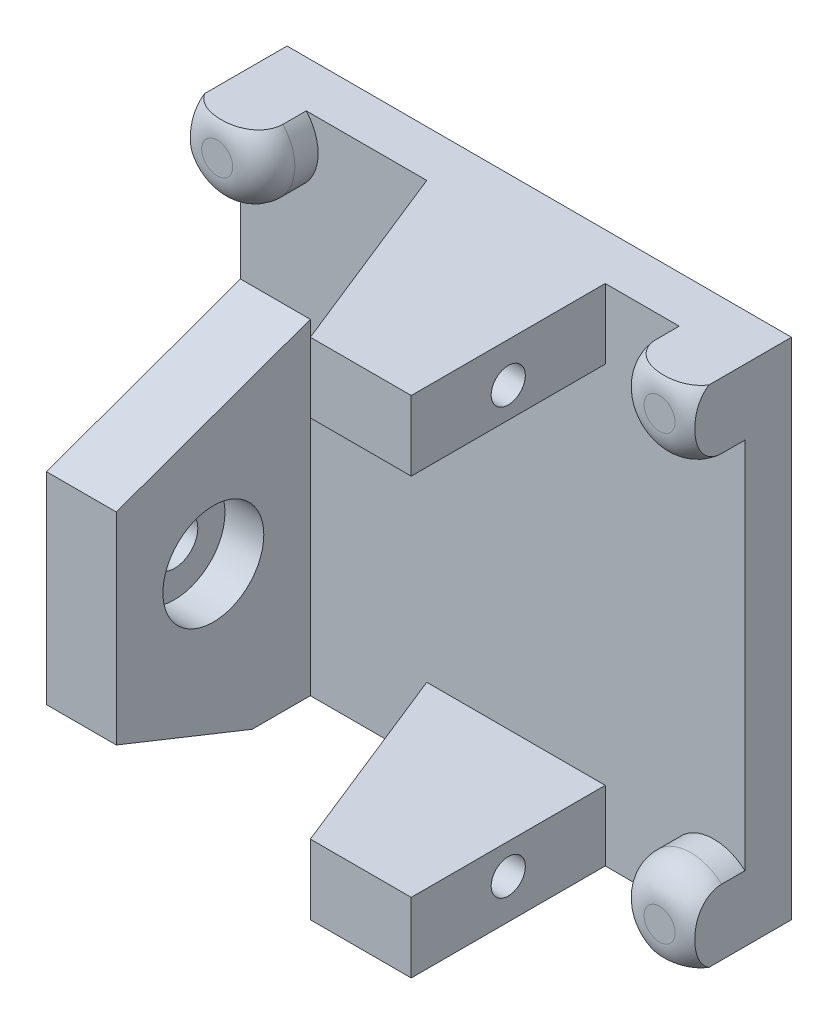
from build123d import *

# Parameters (mm, degrees)
EXTRUDE_640_DEPTH      = 6.25
SKETCH_5_W             = 2.5
SKETCH_5_H             = 8
CUT_EXTRUDE_957_DEPTH  = 4.5
SKETCH_1_W             = 32.5
SKETCH_1_H             = 32.5
EXTRUDE_1522_DEPTH     = 3
SKETCH_4_R             = 1.5
CUT_EXTRUDE_1878_DEPTH = 34.669348078
SKETCH_9_R             = 2.5
CUT_EXTRUDE_4358_DEPTH = 2.5
FILLET_3_R             = 2.5
SKETCH_10_W            = 12.5
SKETCH_10_H            = 12.5
CUT_EXTRUDE_4764_DEPTH = 39.52353177
CUT_EXTRUDE_5191_REACH = 39.495
SKETCH_13_W            = 12.5
SKETCH_13_H            = 16
SKETCH_13_H_2          = 3.5
CHAMFER_3_SIZE         = 5
CHAMFER_3_SIZE_2       = 12.5
SKETCH_5338_R          = 1.1
CUT_EXTRUDE_5550_DEPTH = 8
CHAMFER_START          = -14
CHAMFER_4_DEPTH        = 4.5
EXTRUDE_6314_DEPTH     = 3.5
SKETCH_15_R            = 1
CUT_EXTRUDE_6618_DEPTH = 6
SKETCH_17_R            = 3.25
CUT_EXTRUDE_7180_DEPTH = 2.5


with BuildPart() as part:
    # Эскиз2 → Extrude 640 (new, symmetric)
    with BuildSketch(Plane.XY):
        Polygon((9.5, 16.25), (-14, 16.25), (-14, -16.25), (9.5, -16.25), (9.5, -11.75), (-9.5, -11.75), (-9.5, 11.75), (9.5, 11.75), align=None)
    extrude(amount=EXTRUDE_640_DEPTH, both=True)

    # Эскиз5 → Cut-Extrude 957 (cut)
    with BuildSketch(Plane.XZ.offset(11.75)):
        with Locations((-4.2, 2.25)):
            Rectangle(SKETCH_5_W, SKETCH_5_H)
    extrude(amount=CUT_EXTRUDE_957_DEPTH, mode=Mode.SUBTRACT)

    # Эскиз1 → Extrude 1522 (add)
    with BuildSketch(Plane(origin=(0, 0, -6.25), x_dir=(-1, 0, 0), z_dir=(0, 0, -1))):
        with Locations((-2.25, 0)):
            Rectangle(SKETCH_1_W, SKETCH_1_H)
    extrude(amount=EXTRUDE_1522_DEPTH)

    # Эскиз4 → Cut-Extrude 1878 (cut, through all)
    with BuildSketch(Plane(origin=(-9.5, 0, 0), x_dir=(0, 0, -1), z_dir=(1, 0, 0))):
        with Locations(Location((0, -5.77, 0), (0, 0, 90))):
            Circle(SKETCH_4_R)
    extrude(amount=-CUT_EXTRUDE_1878_DEPTH, mode=Mode.SUBTRACT)

    # Эскиз9 → Cut-Extrude 4358 (cut)
    with BuildSketch(Plane(origin=(0, 0, -9.25), x_dir=(-1, 0, 0), z_dir=(0, 0, -1))):
        with Locations((-11.75, 0)):
            Circle(SKETCH_9_R)
        with Locations((7.25, 0)):
            Circle(SKETCH_9_R)
    extrude(amount=-CUT_EXTRUDE_4358_DEPTH, mode=Mode.SUBTRACT)

    # Скругление3
    fillet_3_edges = [part.edges().sort_by_distance(p)[0] for p in [
        (14.25, 0, -6.75),
        (-4.75, 0, -6.75),
    ]]
    fillet(fillet_3_edges, radius=FILLET_3_R - 0.0001)  # a hair under: the kernel refuses the full size

    # Эскиз10 → Cut-Extrude 4764 (cut, through all)
    with BuildSketch(Plane(origin=(0, 16.25, 0), x_dir=(1, 0, 0), z_dir=(0, 1, 0))):
        with Locations((-3.25, 0)):
            Rectangle(SKETCH_10_W, SKETCH_10_H)
    extrude(amount=-CUT_EXTRUDE_4764_DEPTH, mode=Mode.SUBTRACT)

    # Эскиз13 → Cut-Extrude 5191 (cut, up to next)
    with BuildSketch(Plane.ZY.offset(14), mode=Mode.PRIVATE) as cut_extrude_5191_sk1:
        with Locations((0, 8.25)):
            Rectangle(SKETCH_13_W, SKETCH_13_H)
    cut_extrude_5191_tool1 = extrude(cut_extrude_5191_sk1.sketch, amount=-CUT_EXTRUDE_5191_REACH, mode=Mode.PRIVATE) & part.part
    # Эскиз13 → Cut-Extrude 5191 (cut, up to next)
    with BuildSketch(Plane.ZY.offset(14), mode=Mode.PRIVATE) as cut_extrude_5191_sk2:
        with Locations((0, -14.5)):
            Rectangle(SKETCH_13_W, SKETCH_13_H_2)
    cut_extrude_5191_tool2 = extrude(cut_extrude_5191_sk2.sketch, amount=-CUT_EXTRUDE_5191_REACH, mode=Mode.PRIVATE) & part.part
    add(cut_extrude_5191_tool1.solids().sort_by_distance((-14, 8.25, 0))[0], mode=Mode.SUBTRACT)
    add(cut_extrude_5191_tool2.solids().sort_by_distance((-14, -14.5, 0))[0], mode=Mode.SUBTRACT)

    # Фаска3
    # the kernel refuses this chamfer: 12.5, 5 mm, written as the material it adds along each edge
    with BuildSketch(Plane(origin=(3, 16.25, -6.25), x_dir=(-1, 0, 0), z_dir=(0, -1, 0))) as chamfer_3_piece_1:
        Polygon((CHAMFER_3_SIZE, 0), (0, -CHAMFER_3_SIZE_2), (0, 0), align=None)
    extrude(amount=4.5)
    with BuildSketch(Plane(origin=(3, 48.663920489, -6.25), x_dir=(-1, 0, 0), z_dir=(0, -1, 0))) as chamfer_3_piece_2_section:
        Polygon((CHAMFER_3_SIZE, 0), (0, -CHAMFER_3_SIZE_2), (0, 0), align=None)
    chamfer_3_piece_2 = extrude(amount=69.327840978, mode=Mode.PRIVATE)
    chamfer_3_piece_2 = split(chamfer_3_piece_2, bisect_by=Plane(origin=(3, -16.25, -6.25), z_dir=(0, 1, 0)), keep=Keep.TOP, mode=Mode.PRIVATE)
    chamfer_3_piece_2 = split(chamfer_3_piece_2, bisect_by=Plane(origin=(3, -11.75, -6.25), z_dir=(0, -1, 0)), keep=Keep.TOP, mode=Mode.PRIVATE)
    add(chamfer_3_piece_2)
    with BuildSketch(Plane(origin=(3, 20.663920489, -6.25), x_dir=(0, 0, 1), z_dir=(0, -1, 0))) as chamfer_3_piece_3_section:
        Polygon((CHAMFER_3_SIZE_2, 0), (0, CHAMFER_3_SIZE), (0, 0), align=None)
    chamfer_3_piece_3 = extrude(amount=69.327840978, mode=Mode.PRIVATE)
    chamfer_3_piece_3 = split(chamfer_3_piece_3, bisect_by=Plane(origin=(3, 11.75, -6.25), z_dir=(0, 1, 0)), keep=Keep.TOP, mode=Mode.PRIVATE)
    chamfer_3_piece_3 = split(chamfer_3_piece_3, bisect_by=Plane(origin=(3, 16.25, -6.25), z_dir=(0, -1, 0)), keep=Keep.TOP, mode=Mode.PRIVATE)
    add(chamfer_3_piece_3)
    with BuildSketch(Plane(origin=(3, -11.75, -6.25), x_dir=(0, 0, 1), z_dir=(0, -1, 0))) as chamfer_3_piece_4:
        Polygon((CHAMFER_3_SIZE_2, 0), (0, CHAMFER_3_SIZE), (0, 0), align=None)
    extrude(amount=4.5)
    with BuildSketch(Plane(origin=(-14, -12.75, -6.25), x_dir=(0, -1, 0), z_dir=(1, 0, 0))) as chamfer_3_piece_5_section:
        Polygon((CHAMFER_3_SIZE, 0), (0, -CHAMFER_3_SIZE_2), (0, 0), align=None)
    chamfer_3_piece_5 = extrude(amount=4.5, mode=Mode.PRIVATE)
    chamfer_3_piece_5 = split(chamfer_3_piece_5, bisect_by=Plane(origin=(-14, -16.25, -6.25), z_dir=(0, 1, 0)), keep=Keep.TOP, mode=Mode.PRIVATE)
    add(chamfer_3_piece_5)

    # Sketch 5338 → Cut-Extrude 5550 (cut)
    with BuildSketch(Plane(origin=(9.5, 0, 0), x_dir=(0, 0, -1), z_dir=(1, 0, 0))):
        with Locations((0, 13.7)):
            Circle(SKETCH_5338_R)
        with Locations((0, -13.7)):
            Circle(SKETCH_5338_R)
    extrude(amount=-CUT_EXTRUDE_5550_DEPTH, mode=Mode.SUBTRACT)

    # Фаска4: read off the stored shape, not the designer's step
    # Фаска4 outline → Фаска4 (add)
    with BuildSketch(Plane.YZ.offset(CHAMFER_START)):
        Polygon((0.25, -6.25), (4.75, -6.25), (0.25, 6.25), align=None)
    extrude(amount=CHAMFER_4_DEPTH)

    # Эскиз16 → Extrude 6314 (add)
    with BuildSketch(Plane.XY.offset(-6.25)):
        with BuildLine():
            Line((-14, 12.013932023), (-14, 16.25))
            Line((-14, 16.25), (-9.763932023, 16.25))
            ThreePointArc((-9.763932023, 16.25), (-9.878679656, 12.128679656), (-14, 12.013932023))
        make_face()
        with BuildLine():
            Line((14.263932023, 16.25), (18.5, 16.25))
            Line((18.5, 16.25), (18.5, 12.013932023))
            ThreePointArc((18.5, 12.013932023), (14.378679656, 12.128679656), (14.263932023, 16.25))
        make_face()
        with BuildLine():
            Line((18.5, -12.013932023), (18.5, -16.25))
            Line((18.5, -16.25), (14.263932023, -16.25))
            ThreePointArc((14.263932023, -16.25), (14.378679656, -12.128679656), (18.5, -12.013932023))
        make_face()
    extrude(amount=EXTRUDE_6314_DEPTH)

    # Эскиз15 → Cut-Extrude 6618 (cut)
    with BuildSketch(Plane(origin=(0, 0, -9.25), x_dir=(-1, 0, 0), z_dir=(0, 0, -1))):
        with Locations((12, -14.25)):
            Circle(SKETCH_15_R)
        with Locations((12, 14.25)):
            Circle(SKETCH_15_R)
        with Locations((-16.5, 14.25)):
            Circle(SKETCH_15_R)
        with Locations((-16.5, -14.25)):
            Circle(SKETCH_15_R)
    extrude(amount=-CUT_EXTRUDE_6618_DEPTH, mode=Mode.SUBTRACT)

    # Скругление4: read off the stored shape, not the designer's step
    # Скругление4 outline → Скругление4 (revolve, cut)
    with BuildSketch(Plane(origin=(16.5, 14.25, 0), x_dir=(1, 0, 0), z_dir=(0, -1, 0))):
        with BuildLine():
            ThreePointArc((1, -2.75), (2.414213562, -3.335786438), (3, -4.75))
            Line((3, -4.75), (3, -2.75))
            Line((3, -2.75), (1, -2.75))
        make_face()
    revolve(axis=Axis((16.5, 14.25, 0), (0, 0, 1)), mode=Mode.SUBTRACT)

    # Fillet 4 2 outline → Fillet 4 2 (revolve, cut)
    with BuildSketch(Plane(origin=(-12, 14.25, 0), x_dir=(1, 0, 0), z_dir=(0, -1, 0))):
        with BuildLine():
            ThreePointArc((1, -2.75), (2.414213562, -3.335786438), (3, -4.75))
            Line((3, -4.75), (3, -2.75))
            Line((3, -2.75), (1, -2.75))
        make_face()
    revolve(axis=Axis((-12, 14.25, 0), (0, 0, 1)), mode=Mode.SUBTRACT)

    # Fillet 4 3 outline → Fillet 4 3 (revolve, cut)
    with BuildSketch(Plane(origin=(16.5, -14.25, 0), x_dir=(1, 0, 0), z_dir=(0, -1, 0))):
        with BuildLine():
            ThreePointArc((1, -2.75), (2.414213562, -3.335786438), (3, -4.75))
            Line((3, -4.75), (3, -2.75))
            Line((3, -2.75), (1, -2.75))
        make_face()
    revolve(axis=Axis((16.5, -14.25, 0), (0, 0, 1)), mode=Mode.SUBTRACT)

    # Эскиз17 → Cut-Extrude 7180 (cut)
    with BuildSketch(Plane(origin=(-9.5, 0, 0), x_dir=(0, 0, -1), z_dir=(1, 0, 0))):
        with Locations((0, -5.77)):
            Circle(SKETCH_17_R)
    extrude(amount=-CUT_EXTRUDE_7180_DEPTH, mode=Mode.SUBTRACT)


solid = part.part
